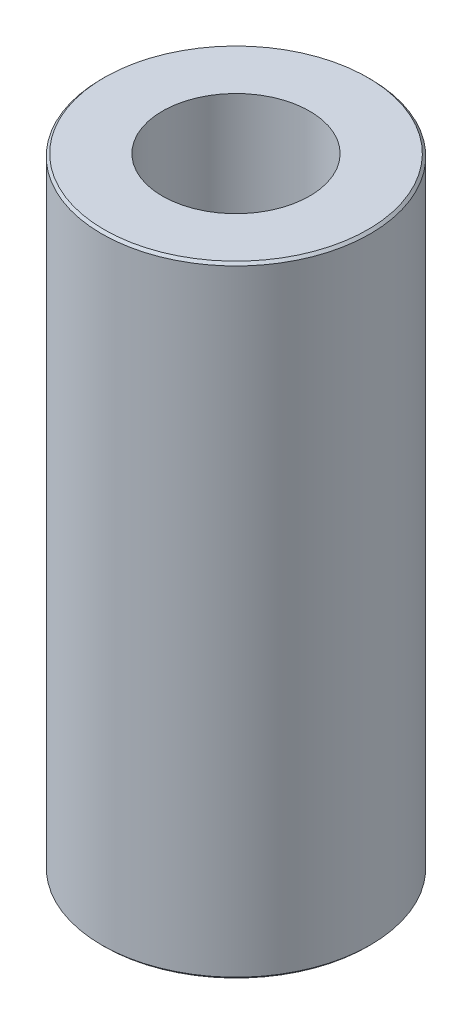
from build123d import *

# Parameters (mm, degrees)
SKETCH1_R           = 40
BOSS_EXTRUDE1_DEPTH = 185.014265715
SKETCH2_R           = 21.949456349
CUT_EXTRUDE1_DEPTH  = 194.469063465
CHAMFER1_SIZE       = 0.728395525


with BuildPart() as part:
    # Sketch1 → Boss-Extrude1 (new body)
    with BuildSketch(Plane(origin=(0, 0, 0), x_dir=(1, 0, 0), z_dir=(0, 1, 0))):
        Circle(SKETCH1_R)
    extrude(amount=BOSS_EXTRUDE1_DEPTH)

    # Sketch2 → Cut-Extrude1 (cut, through all)
    with BuildSketch(Plane(origin=(0, 0, 0), x_dir=(1, 0, 0), z_dir=(0, 1, 0))):
        Circle(SKETCH2_R)
    extrude(amount=CUT_EXTRUDE1_DEPTH, mode=Mode.SUBTRACT)

    # Chamfer1
    chamfer1_edges = [part.edges().sort_by_distance(p)[0] for p in [
        (-40, 185.014265715, 0),
        (-40, 0, 0),
    ]]
    chamfer(chamfer1_edges, length=CHAMFER1_SIZE)


solid = part.part
